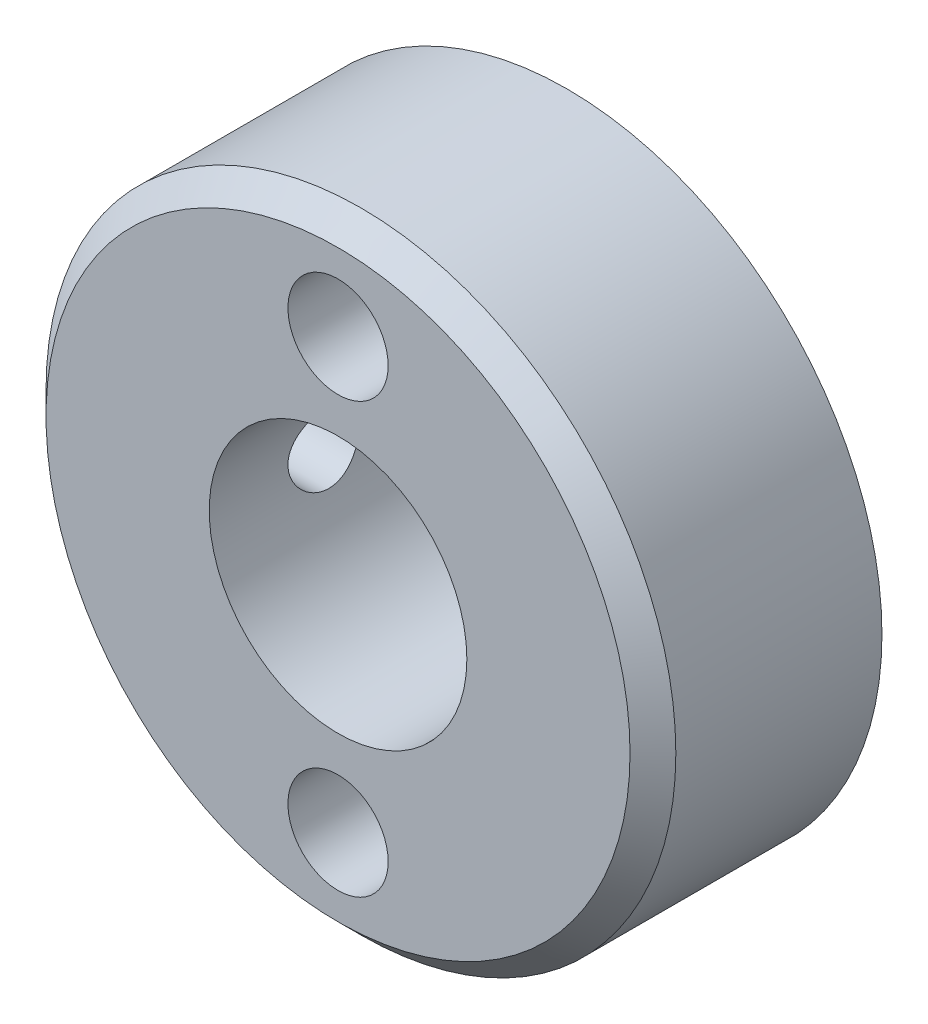
from build123d import *

# Parameters (mm, degrees)
SKETCH1_R          = 11
SKETCH1_R_2        = 4.5
BASENUT_DEPTH      = 8
CHAMFER1_SIZE      = 0.8
SKETCH3_R          = 1.25
CUT_EXTRUDE1_DEPTH = 18.492855685


with BuildPart() as part:
    # Sketch1 → BaseNut (new body)
    with BuildSketch(Plane.XY):
        Circle(SKETCH1_R)
        Circle(SKETCH1_R_2, mode=Mode.SUBTRACT)
    extrude(amount=-BASENUT_DEPTH)

    # Sketch5 → Cut-Revolve1 (revolve, cut)
    with BuildSketch(Plane(origin=(0, 0, 0), x_dir=(0, 0, -1), z_dir=(1, 0, 0))):
        Polygon((0, 7.5), (0, 9.25), (4, 9.25), (5.010362971, 7.5), align=None)
    cut_revolve1 = revolve(axis=Axis((0, 7.5, 6.070310336), (0, 0, -1)), mode=Mode.SUBTRACT)

    # Chamfer1
    chamfer1_edges = [part.edges().sort_by_distance(p)[0] for p in [
        (-11, 0, 0),
        (-4.5, 0, -8),
    ]]
    chamfer(chamfer1_edges, length=CHAMFER1_SIZE)

    # Sketch3 → Cut-Extrude1 (cut, through all)
    with BuildSketch(Plane(origin=(0, 0, 0), x_dir=(0, -1, 0), z_dir=(1, 0, 0))):
        with Locations((0, 4)):
            Circle(SKETCH3_R)
    extrude(amount=-CUT_EXTRUDE1_DEPTH, mode=Mode.SUBTRACT)

    # Mirror1: Cut-Revolve1 across plane
    add(cut_revolve1.mirror(Plane.ZX), mode=Mode.SUBTRACT)


solid = part.part
